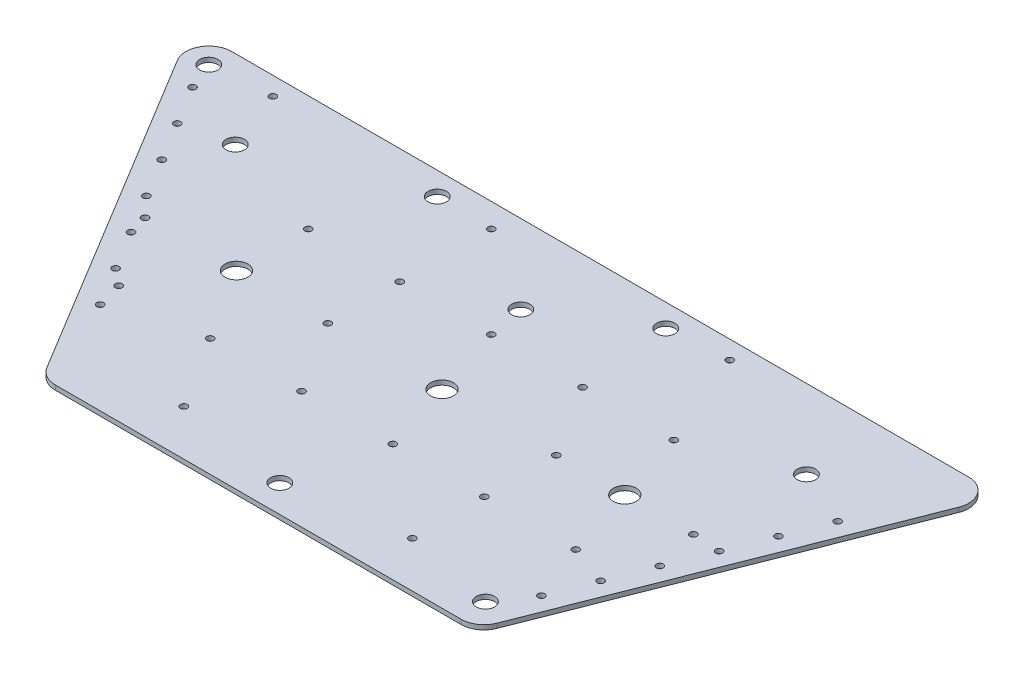
from build123d import *

# Parameters (mm, degrees)
BOSS_EXTRUDE1_DEPTH = 2
FILLET1_R           = 10
SKETCH3_R           = 1.5
SKETCH3_R_2         = 4
SKETCH3_R_3         = 5
CUT_EXTRUDE1_DEPTH  = 2


with BuildPart() as part:
    # Sketch2 → Boss-Extrude1 (new body)
    with BuildSketch(Plane(origin=(0, 0, 0), x_dir=(1, 0, 0), z_dir=(0, 1, 0))):
        Polygon((0, 0), (65, 165), (-290, 165), (-190, 0), align=None)
    extrude(amount=BOSS_EXTRUDE1_DEPTH)

    # Fillet1
    fillet1_edges = [part.edges().sort_by_distance(p)[0] for p in [
        (-190, 1, 0),
        (-290, 1, -165),
        (65, 1, -165),
        (0, 1, 0),
    ]]
    fillet(fillet1_edges, radius=FILLET1_R)

    # Sketch3 → Cut-Extrude1 (cut)
    with BuildSketch(Plane(origin=(0, 2, 0), x_dir=(1, 0, 0), z_dir=(0, 1, 0))):
        with Locations((-228.170289346, 83)):
            Circle(SKETCH3_R)
        with Locations((-246.246193102, 157)):
            Circle(SKETCH3_R)
        with Locations((-46.246193102, 157)):
            Circle(SKETCH3_R)
        with Locations((11.829710654, 83)):
            Circle(SKETCH3_R)
        with Locations((-272.246193102, 155)):
            Circle(SKETCH3_R_2)
        with Locations((-172.246193102, 155)):
            Circle(SKETCH3_R_2)
        with Locations((13.829710654, 130.5)):
            Circle(SKETCH3_R_2)
        with Locations((-236.170289346, 130.5)):
            Circle(SKETCH3_R_2)
        with Locations((-111.170289346, 130.5)):
            Circle(SKETCH3_R_2)
        with Locations((-18.170289346, 83)):
            Circle(SKETCH3_R_3)
        with Locations((-188.170289346, 83)):
            Circle(SKETCH3_R_3)
        with Locations((-98.170289346, 83)):
            Circle(SKETCH3_R_3)
        with Locations((-205.049987171, 40.267503937)):
            Circle(SKETCH3_R)
        with Locations((-208.170289346, 51.5)):
            Circle(SKETCH3_R)
        with Locations((-225.782055815, 74.475417199)):
            Circle(SKETCH3_R)
        with Locations((-236.148090136, 91.57937383)):
            Circle(SKETCH3_R)
        with Locations((-246.514124458, 108.683330462)):
            Circle(SKETCH3_R)
        with Locations((-256.88015878, 125.787287093)):
            Circle(SKETCH3_R)
        with Locations((-267.246193102, 142.891243724)):
            Circle(SKETCH3_R)
        with Locations((1.829710654, 26.47129363)):
            Circle(SKETCH3_R)
        with Locations((9.160201021, 45.079461487)):
            Circle(SKETCH3_R)
        with Locations((16.490691389, 63.687629343)):
            Circle(SKETCH3_R)
        with Locations((23.821181757, 82.295797199)):
            Circle(SKETCH3_R)
        with Locations((31.151672124, 100.903965056)):
            Circle(SKETCH3_R)
        with Locations((38.482162492, 119.512132912)):
            Circle(SKETCH3_R)
        with Locations((-72.246193102, 155)):
            Circle(SKETCH3_R_2)
        with Locations((-148.170289346, 154.5)):
            Circle(SKETCH3_R)
        with Locations((-188.170289346, 114.5)):
            Circle(SKETCH3_R)
        with Locations((-148.170289346, 114.5)):
            Circle(SKETCH3_R)
        with Locations((-108.170289346, 114.5)):
            Circle(SKETCH3_R)
        with Locations((-68.170289346, 114.5)):
            Circle(SKETCH3_R)
        with Locations((-28.170289346, 114.5)):
            Circle(SKETCH3_R)
        with Locations((-148.170289346, 83)):
            Circle(SKETCH3_R)
        with Locations((-215.416021493, 57.371460568)):
            Circle(SKETCH3_R)
        with Locations((-168.170289346, 51.5)):
            Circle(SKETCH3_R)
        with Locations((-8.170289346, 51.5)):
            Circle(SKETCH3_R)
        with Locations((-128.170289346, 51.5)):
            Circle(SKETCH3_R)
        with Locations((-88.170289346, 51.5)):
            Circle(SKETCH3_R)
        with Locations((-48.170289346, 83)):
            Circle(SKETCH3_R)
        with Locations((-48.170289346, 51.5)):
            Circle(SKETCH3_R)
        with Locations((-8.170289346, 12)):
            Circle(SKETCH3_R_2)
        with Locations((-148.170289346, 20)):
            Circle(SKETCH3_R)
        with Locations((-98.170289346, 12)):
            Circle(SKETCH3_R_2)
        with Locations((-48.170289346, 20)):
            Circle(SKETCH3_R)
    extrude(amount=-CUT_EXTRUDE1_DEPTH, mode=Mode.SUBTRACT)


solid = part.part
